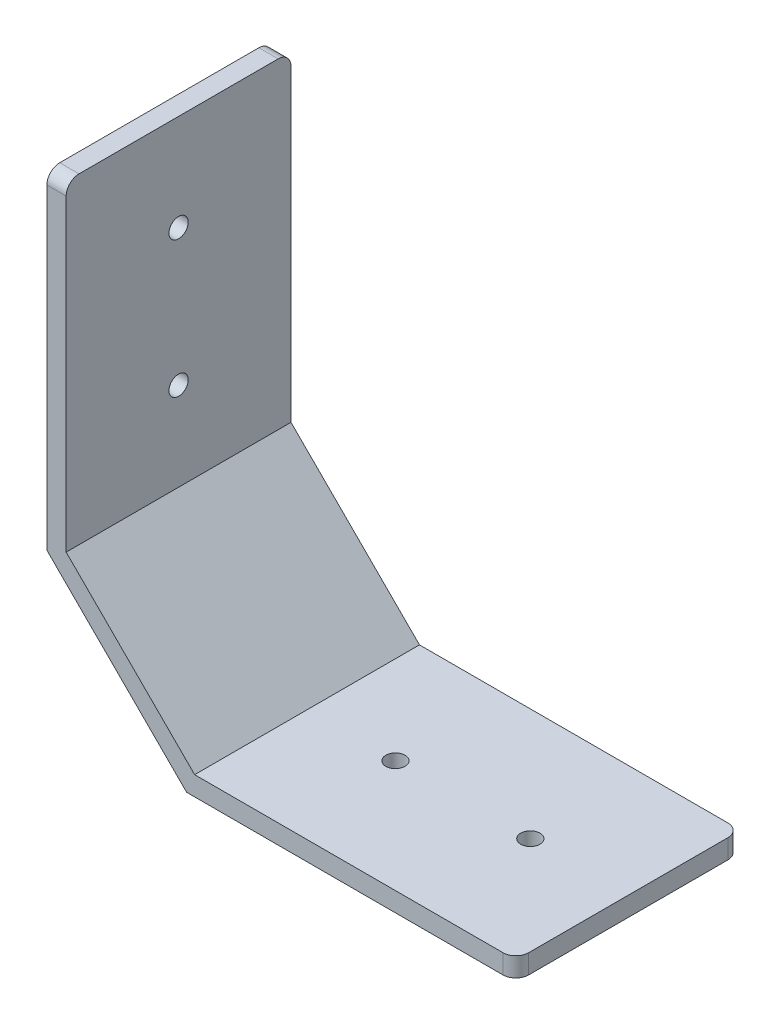
from build123d import *

# Parameters (mm, degrees)
EXTRU_MINCE1_DEPTH      = 35
CONG_3_R                = 2
CONG_4_R                = 2
CONG_5_R                = 2
CONG_6_R                = 2
ESQUISSE2_R             = 1.5
ENL_V_MAT_EXTRU_1_DEPTH = 10
ESQUISSE3_R             = 1.5
ENL_V_MAT_EXTRU_2_DEPTH = 10


with BuildPart() as part:
    # Esquisse1 → Extru.-Mince1 (new body)
    with BuildSketch(Plane.XY):
        Polygon((70, -20), (20, -20), (0, 0), (0, 50), (-3, 50), (-3, -1.242640687), (18.757359313, -23), (70, -23), align=None)
    extrude(amount=EXTRU_MINCE1_DEPTH)

    # Congé3
    cong_3_edges = [part.edges().sort_by_distance(p)[0] for p in [
        (-1.5, 50, 35),
    ]]
    fillet(cong_3_edges, radius=CONG_3_R)

    # Congé4
    cong_4_edges = [part.edges().sort_by_distance(p)[0] for p in [
        (-1.5, 50, 0),
    ]]
    fillet(cong_4_edges, radius=CONG_4_R)

    # Congé5
    cong_5_edges = [part.edges().sort_by_distance(p)[0] for p in [
        (70, -21.5, 35),
    ]]
    fillet(cong_5_edges, radius=CONG_5_R)

    # Congé6
    cong_6_edges = [part.edges().sort_by_distance(p)[0] for p in [
        (70, -21.5, 0),
    ]]
    fillet(cong_6_edges, radius=CONG_6_R)

    # Esquisse2 → Enlèv. mat.-Extru.1 (cut)
    with BuildSketch(Plane.XZ.offset(23)):
        with Locations((33.757359313, 17.5)):
            Circle(ESQUISSE2_R)
        with Locations((54.757359313, 17.5)):
            Circle(ESQUISSE2_R)
    extrude(amount=-ENL_V_MAT_EXTRU_1_DEPTH, mode=Mode.SUBTRACT)

    # Esquisse3 → Enlèv. mat.-Extru.2 (cut)
    with BuildSketch(Plane.ZY.offset(3)):
        with Locations((17.5, 35)):
            Circle(ESQUISSE3_R)
        with Locations((17.5, 13.757359313)):
            Circle(ESQUISSE3_R)
    extrude(amount=-ENL_V_MAT_EXTRU_2_DEPTH, mode=Mode.SUBTRACT)


solid = part.part
